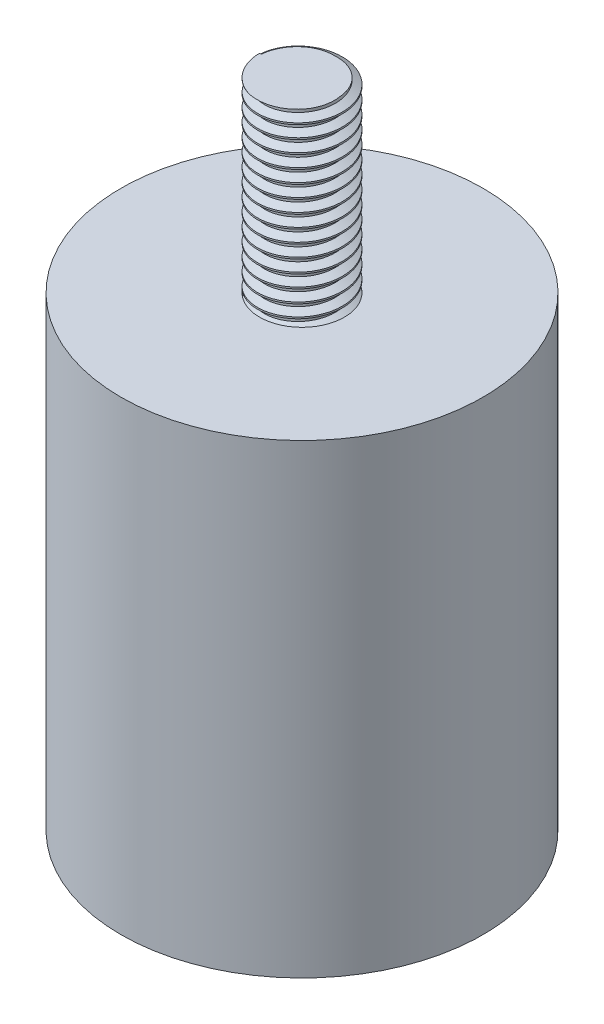
from build123d import *

# Parameters (mm, degrees)
IZIM1_W               = 4.1
IZIM1_H               = 18
IZIM1_W_2             = 17.5
IZIM1_H_2             = 45
DI_1_PITCH            = 1.25
M8_DI_LI_DELIK1_D     = 6.8
M8_DI_LI_DELIK1_DEPTH = 15
M8_DI_LI_DELIK1_TIP   = 2.042926105


with BuildPart() as part:
    # Çizim1 → Döndür1 (revolve)
    with BuildSketch(Plane.XY, mode=Mode.PRIVATE) as d_nd_r1_sk:
        with Locations((15.45, 54)):
            Rectangle(IZIM1_W, IZIM1_H)
        with Locations((8.75, 22.5)):
            Rectangle(IZIM1_W_2, IZIM1_H_2)
    revolve(d_nd_r1_sk.sketch.rotate(Axis((17.5, 0, 0), (0, 1, 0)), 270), axis=Axis((17.5, 0, 0), (0, 1, 0)))

    # Diş1: the profile of Diş Profili1 profile screwed along a right-hand helix of 15.2 turns, 8 arcs to a turn; built about Z, then put on its axis
    di_1_z = Axis((0, 0, 0), (0, 0, 1))
    di_1_corners = [(4.1003, 0, -0.000173205), (4.1003, 0, 1.093923202), (3.423417656, 0, 0.703124998), (3.423417656, 0, 0.390624998)]
    with BuildLine(mode=Mode.PRIVATE) as di_1_profile:
        Line(di_1_corners[0], di_1_corners[1])
        Line(di_1_corners[1], di_1_corners[2])
        Line(di_1_corners[2], di_1_corners[3])
        Line(di_1_corners[3], di_1_corners[0])
    di_1_cap = Face(di_1_profile.wire())
    di_1_turn_angles = [0, 22.5, 45, 67.5, 90, 112.5, 135, 157.5, 180, 202.5, 225, 247.5, 270, 292.5, 315, 337.5, 360]
    di_1_turn_weights = [1, 0.9238795325112867, 1, 0.9238795325112867, 1, 0.9238795325112867, 1, 0.9238795325112867, 1, 0.9238795325112867, 1, 0.9238795325112867, 1, 0.9238795325112867, 1, 0.9238795325112867, 1]
    di_1_turn_rails = [Edge.make_bspline([Vector(p[0], p[1], 0).rotate(di_1_z, di_1_turn_angles[k]) / di_1_turn_weights[k] + Vector(0, 0, p[2] + DI_1_PITCH * di_1_turn_angles[k] / 360) for k in range(17)], [0, 0, 0, 1, 1, 2, 2, 3, 3, 4, 4, 5, 5, 6, 6, 7, 7, 8, 8, 8], 2, di_1_turn_weights) for p in di_1_corners]
    di_1_turn_sides = [Face.make_surface_from_curves(di_1_turn_rails[p[0]], di_1_turn_rails[p[1]]) for p in [(0, 1), (1, 2), (2, 3), (3, 0)]]
    di_1_last_angles = [5400, 5422.5, 5445, 5458.5, 5472]
    di_1_last_weights = [1, 0.9238795325112867, 1, 0.9723699203976748, 1]
    di_1_last_rails = [Edge.make_bspline([Vector(p[0], p[1], 0).rotate(di_1_z, di_1_last_angles[k]) / di_1_last_weights[k] + Vector(0, 0, p[2] + DI_1_PITCH * di_1_last_angles[k] / 360) for k in range(5)], [0, 0, 0, 1, 1, 2, 2, 2], 2, di_1_last_weights) for p in di_1_corners]
    di_1_last_sides = [Face.make_surface_from_curves(di_1_last_rails[p[0]], di_1_last_rails[p[1]]) for p in [(0, 1), (1, 2), (2, 3), (3, 0)]]
    di_1 = Plane(origin=(17.5, 64, 0), x_dir=(-1, 0, 0), z_dir=(0, -1, 0)) * Solid(Shell([*[p.moved(Location((0, 0, DI_1_PITCH * i))) for i in range(15) for p in di_1_turn_sides], *di_1_last_sides, di_1_cap, di_1_cap.rotate(di_1_z, 5472).moved(Location((0, 0, DI_1_PITCH * 5472 / 360)))]))
    add(di_1, mode=Mode.SUBTRACT)

    # M8 Dişli Delik1
    with Locations(Plane(origin=(0, 0, 0), x_dir=(-1, 0, 0), z_dir=(0, -1, 0))):
        with Locations((-17.5, 0)):
            Hole(M8_DI_LI_DELIK1_D / 2, depth=M8_DI_LI_DELIK1_DEPTH)
            with Locations((0, 0, -(M8_DI_LI_DELIK1_DEPTH + M8_DI_LI_DELIK1_TIP / 2))):  # 118° drill point
                Cone(0, M8_DI_LI_DELIK1_D / 2, M8_DI_LI_DELIK1_TIP, mode=Mode.SUBTRACT)


solid = part.part
